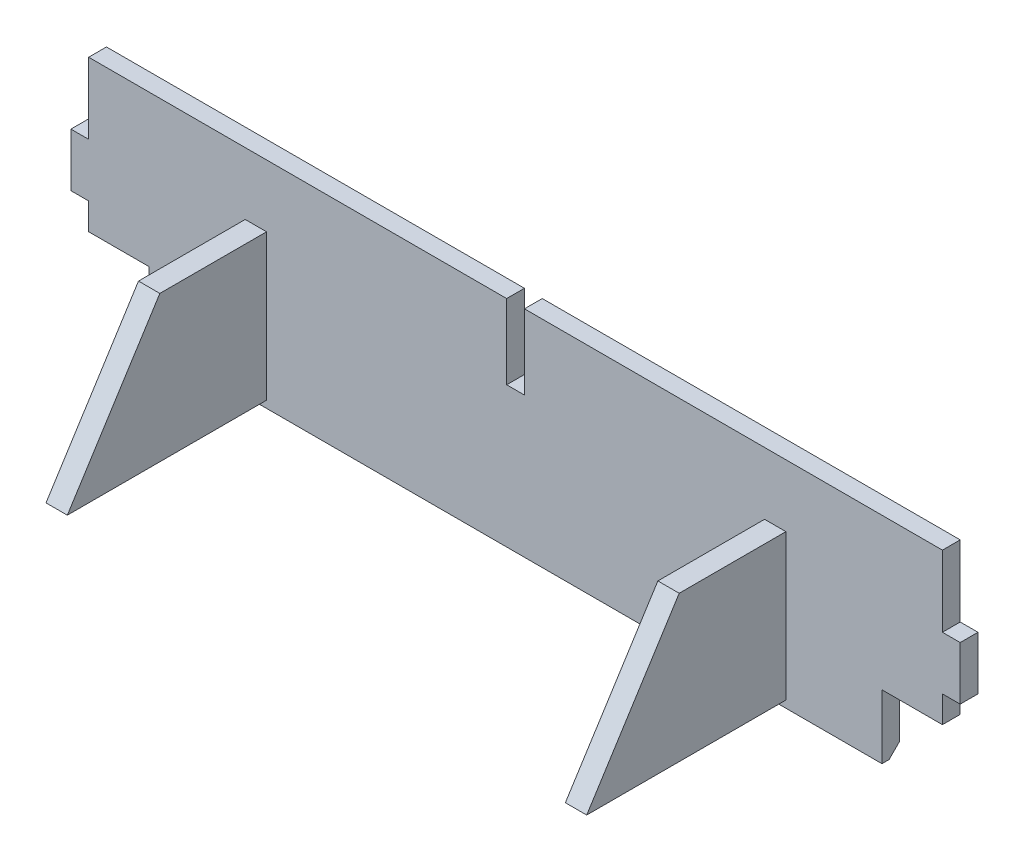
from build123d import *

# Parameters (mm, degrees)
BOSS_EXTRU_1_DEPTH      = 5
ESQUISSE2_W             = 17
ESQUISSE2_H             = 18
ENL_V_MAT_EXTRU_1_DEPTH = 253.408894455
ESQUISSE3_W             = 6
ESQUISSE3_H             = 41
BOSS_EXTRU_2_DEPTH      = 70
ENL_V_MAT_EXTRU_3_DEPTH = 223.904127373
CHANFREIN1_SIZE         = 3
ESQUISSE7_R             = 1.5
ENL_V_MAT_EXTRU_4_DEPTH = 25


# Read off the part's stored shape, not the designer's step: Boss.-Extru.1
with BuildPart() as part:
    # Boss.-Extru.1 outline → Boss.-Extru.1 (new body)
    with BuildSketch(Plane.XY):
        Polygon((0, 25.5), (0, 0), (240, 0), (240, 25.5), (245, 25.5), (245, 40.5), (240, 40.5), (240, 60.5), (122.5, 60.5), (122.5, 39.5), (117.5, 39.5), (117.5, 60.5), (0, 60.5), (0, 40.5), (-5, 40.5), (-5, 25.5), align=None)
    extrude(amount=BOSS_EXTRU_1_DEPTH)

    # Esquisse2 → Enlèv. mat.-Extru.1 (cut, through all)
    with BuildSketch(Plane.XY.offset(5)):
        with Locations((231.5, 9)):
            Rectangle(ESQUISSE2_W, ESQUISSE2_H)
        with Locations((8.5, 9)):
            Rectangle(ESQUISSE2_W, ESQUISSE2_H)
    extrude(amount=-ENL_V_MAT_EXTRU_1_DEPTH, mode=Mode.SUBTRACT)

    # Esquisse3 → Boss.-Extru.2 (add)
    with BuildSketch(Plane.XY.offset(5)):
        with Locations((47, 22.5)):
            Rectangle(ESQUISSE3_W, ESQUISSE3_H)
        with Locations((193, 22.5)):
            Rectangle(ESQUISSE3_W, ESQUISSE3_H)
    extrude(amount=BOSS_EXTRU_2_DEPTH)

    # Esquisse6 → Enlèv. mat.-Extru.3 (cut, through all)
    with BuildSketch(Plane.ZY.offset(-44)):
        Polygon((35, 43), (75, 43), (75, 2), (61, 2), align=None)
    extrude(amount=-ENL_V_MAT_EXTRU_3_DEPTH, mode=Mode.SUBTRACT)

    # Chanfrein1
    chanfrein1_edges = [part.edges().sort_by_distance(p)[0] for p in [
        (120, 0, 0),
    ]]
    chamfer(chanfrein1_edges, length=CHANFREIN1_SIZE)

    # Esquisse7 → Enlèv. mat.-Extru.4 (cut)
    with BuildSketch(Plane.XZ.offset(-2)):
        with Locations(Location((47, 25, 0), (0, 0, 270))):
            Circle(ESQUISSE7_R)
        with Locations(Location((47, 41, 0), (0, 0, 270))):
            Circle(ESQUISSE7_R)
        with Locations(Location((193, 41, 0), (0, 0, 270))):
            Circle(ESQUISSE7_R)
        with Locations(Location((193, 25, 0), (0, 0, 270))):
            Circle(ESQUISSE7_R)
    extrude(amount=-ENL_V_MAT_EXTRU_4_DEPTH, mode=Mode.SUBTRACT)


solid = part.part
